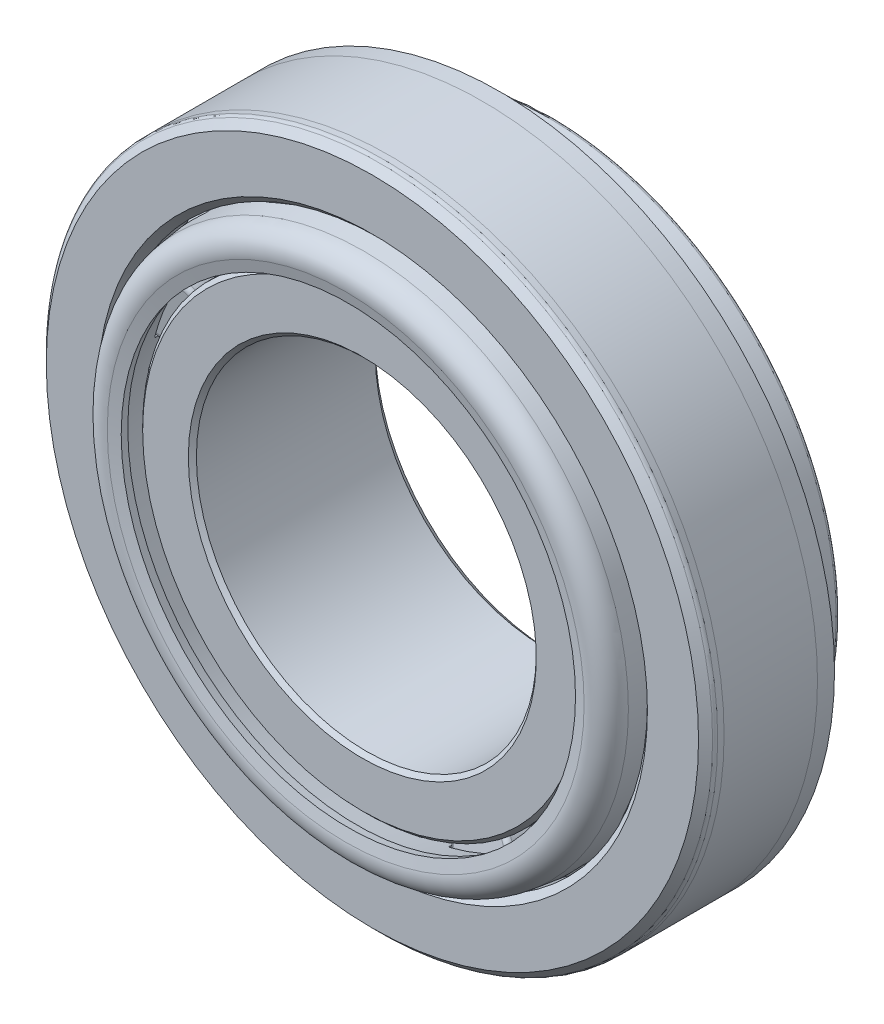
from build123d import *
from OCP.BRepFilletAPI import BRepFilletAPI_MakeChamfer

# Parameters (mm, degrees)
SKETCH8_R                 = 1.3275
CUT_EXTRUDE1_DEPTH        = 0.635
FILLET7_R                 = 0.9525
CHAMFER4_SIZE             = 0.331875
CHAMFER4_SIZE2            = 0.322096273
FILLET8_R                 = 0.3585
CIRPATTERN1_COUNT         = 16
FILLET9_R                 = 1.6
FILLET10_R                = 0.2145
FILLET11_R                = 0.239
CIRPATTERN2_COUNT         = 16
FILLET11_OF_CIRPATTERN2_R = 0.239
CHAMFER1_SIZE             = 0.6364125
CHAMFER1_SIZE2            = 0.519546857
FILLET6_R                 = 0.3818475
CHAMFER2_SIZE             = 0.301125
CHAMFER3_SIZE             = 0.5825


with BuildPart() as part:
    # Sketch2 → Revolve1 (revolve)
    with BuildSketch(Plane(origin=(0, 0, 0), x_dir=(0, 0, -1), z_dir=(1, 0, 0)), mode=Mode.PRIVATE) as revolve1_sk:
        Polygon((-4.7625, 25.0063), (-4.7625, 19.915), (4.7625, 22.47), (4.7625, 25.0063), align=None)
    revolve(revolve1_sk.sketch.rotate(Axis((0, 0, 0), (0, 0, -1)), 90), axis=Axis((0, 0, 0), (0, 0, -1)))

    # Chamfer1: one chamfer whose edges measure the first distance from different faces: ONE call of the kernel's chamfer builder (chamfer() names one face for all edges)
    chamfer1_edges_1 = [part.edges().sort_by_distance(p)[0] for p in [
        (-19.915, 0, 4.7625),
    ]]
    chamfer1_side_1 = [part.faces().sort_by_distance(p)[0] for p in [
        (-24.299015028, 0, 4.7625),
    ]]
    chamfer1_edges_2 = [part.edges().sort_by_distance(p)[0] for p in [
        (-25.0063, 0, 4.7625),
    ]]
    chamfer1 = BRepFilletAPI_MakeChamfer(part.part.solid().wrapped)
    for e in chamfer1_edges_1:
        chamfer1.Add(CHAMFER1_SIZE, CHAMFER1_SIZE2, e.wrapped, chamfer1_side_1[0].wrapped)  # the first distance lies on this face
    for e in chamfer1_edges_2:
        chamfer1.Add(CHAMFER1_SIZE, e.wrapped)
    add(Compound.cast(chamfer1.Shape()), mode=Mode.REPLACE)

    # Fillet6
    fillet6_edges = [part.edges().sort_by_distance(p)[0] for p in [
        (-25.0063, 0, 4.1260875),
    ]]
    fillet(fillet6_edges, radius=FILLET6_R)


with BuildPart() as body_2:
    # Sketch3 → Revolve2 (revolve)
    with BuildSketch(Plane(origin=(0, 0, 0), x_dir=(0, 0, -1), z_dir=(1, 0, 0)), mode=Mode.PRIVATE) as revolve2_sk:
        Polygon((-5.51688, 16.715), (-5.51688, 12.7), (8.73252, 12.7), (8.73252, 18.525), (5.040483008, 18.525), (5.367251191, 17.137115196), (-3.054855979, 15.426432346), (-3.358240605, 16.715), align=None)
    revolve(revolve2_sk.sketch.rotate(Axis((0, 0, 0), (0, 0, -1)), 90), axis=Axis((0, 0, 0), (0, 0, -1)))

    # Chamfer2
    chamfer2_edges = [body_2.edges().sort_by_distance(p)[0] for p in [
        (-12.7, 0, 5.51688),
        (-16.715, 0, 5.51688),
    ]]
    chamfer(chamfer2_edges, length=CHAMFER2_SIZE)

    # Chamfer3
    chamfer3_edges = [body_2.edges().sort_by_distance(p)[0] for p in [
        (-18.525, 0, -8.73252),
        (-12.7, 0, -8.73252),
    ]]
    chamfer(chamfer3_edges, length=CHAMFER3_SIZE)


with BuildPart() as body_3:
    # Sketch4 → Revolve3 (revolve)
    with BuildSketch(Plane(origin=(0, 0, 0), x_dir=(0, 0, -1), z_dir=(1, 0, 0)), mode=Mode.PRIVATE) as revolve3_sk:
        Polygon((8.70712, 20.907896237), (8.555863227, 21.550330194), (-7.164983268, 19.543904717), (-6.559994841, 16.97433311), (-5.917560884, 17.125589883), (-5.99318927, 17.446806861), align=None)
    revolve(revolve3_sk.sketch.rotate(Axis((0, 0, 0), (0, 0, -1)), 90), axis=Axis((0, 0, 0), (0, 0, -1)))

    # Fillet9
    fillet9_edges = [body_3.edges().sort_by_distance(p)[0] for p in [
        (-19.543904717, 0, 7.164983268),
    ]]
    fillet(fillet9_edges, radius=FILLET9_R)

    # Fillet10
    fillet10_edges = [body_3.edges().sort_by_distance(p)[0] for p in [
        (-21.550330194, 0, -8.555863227),
        (-20.907896237, 0, -8.70712),
    ]]
    fillet(fillet10_edges, radius=FILLET10_R)

    # Sketch9 → Cut-Revolve2 (revolve, cut)
    with BuildSketch(Plane(origin=(0, 0, 0), x_dir=(0, 0, -1), z_dir=(1, 0, 0)), mode=Mode.PRIVATE) as cut_revolve2_sk:
        Polygon((-3.602588839, 17.752821976), (4.758786445, 19.721451794), (5.408350699, 16.962552967), (-3.013756471, 15.251870116), align=None)
    cut_revolve2 = revolve(cut_revolve2_sk.sketch.rotate(Axis((0, 17.752821976, 3.602588839), (0, 0.2291769287577538, -0.9733847827684402)), 180), axis=Axis((0, 17.752821976, 3.602588839), (0, 0.2291769287577538, -0.9733847827684402)), mode=Mode.SUBTRACT)

    # Fillet11
    fillet11_edges = [body_3.edges().sort_by_distance(p)[0] for p in [
        (-2.222070994, 19.008406949, 3.898207913),
        (2.222070994, 19.008406949, 3.898207913),
        (2.763109607, 20.336059128, -4.614081264),
        (-2.763109607, 20.336059128, -4.614081264),
    ]]
    fillet(fillet11_edges, radius=FILLET11_R)

    # CirPattern2: Cut-Revolve2 ×16 about axis
    cirpattern2_axis = Axis((0, 0, 0), (0, 0, 1))
    for i in range(1, CIRPATTERN2_COUNT):
        add(cut_revolve2.rotate(cirpattern2_axis, i * 360 / CIRPATTERN2_COUNT), mode=Mode.SUBTRACT)

    # Fillet11 of CirPattern2
    fillet11_of_cirpattern2_edges = [body_3.edges().sort_by_distance(p)[0] for p in [
        (-9.327128327, 16.711128371, 3.898207913),
        (-5.221276504, 18.411827881, 3.898207913),
        (-5.229492496, 19.845465069, -4.614081264),
        (-10.33505332, 17.730672532, -4.614081264),
        (-15.012214922, 11.869731985, 3.898207913),
        (-11.869731985, 15.012214922, 3.898207913),
        (-12.425951772, 16.333578852, -4.614081264),
        (-16.333578852, 12.425951772, -4.614081264),
        (-18.411827881, 5.221276504, 3.898207913),
        (-16.711128371, 9.327128327, 3.898207913),
        (-17.730672532, 10.33505332, -4.614081264),
        (-19.845465069, 5.229492496, -4.614081264),
        (-19.008406949, -2.222070994, 3.898207913),
        (-19.008406949, 2.222070994, 3.898207913),
        (-20.336059128, 2.763109607, -4.614081264),
        (-20.336059128, -2.763109607, -4.614081264),
        (-16.711128371, -9.327128327, 3.898207913),
        (-18.411827881, -5.221276504, 3.898207913),
        (-19.845465069, -5.229492496, -4.614081264),
        (-17.730672532, -10.33505332, -4.614081264),
        (-11.869731985, -15.012214922, 3.898207913),
        (-15.012214922, -11.869731985, 3.898207913),
        (-16.333578852, -12.425951772, -4.614081264),
        (-12.425951772, -16.333578852, -4.614081264),
        (-5.221276504, -18.411827881, 3.898207913),
        (-9.327128327, -16.711128371, 3.898207913),
        (-10.33505332, -17.730672532, -4.614081264),
        (-5.229492496, -19.845465069, -4.614081264),
        (2.222070994, -19.008406949, 3.898207913),
        (-2.222070994, -19.008406949, 3.898207913),
        (-2.763109607, -20.336059128, -4.614081264),
        (2.763109607, -20.336059128, -4.614081264),
        (9.327128327, -16.711128371, 3.898207913),
        (5.221276504, -18.411827881, 3.898207913),
        (5.229492496, -19.845465069, -4.614081264),
        (10.33505332, -17.730672532, -4.614081264),
        (15.012214922, -11.869731985, 3.898207913),
        (11.869731985, -15.012214922, 3.898207913),
        (12.425951772, -16.333578852, -4.614081264),
        (16.333578852, -12.425951772, -4.614081264),
        (18.411827881, -5.221276504, 3.898207913),
        (16.711128371, -9.327128327, 3.898207913),
        (17.730672532, -10.33505332, -4.614081264),
        (19.845465069, -5.229492496, -4.614081264),
        (19.008406949, 2.222070994, 3.898207913),
        (19.008406949, -2.222070994, 3.898207913),
        (20.336059128, -2.763109607, -4.614081264),
        (20.336059128, 2.763109607, -4.614081264),
        (16.711128371, 9.327128327, 3.898207913),
        (18.411827881, 5.221276504, 3.898207913),
        (19.845465069, 5.229492496, -4.614081264),
        (17.730672532, 10.33505332, -4.614081264),
        (11.869731985, 15.012214922, 3.898207913),
        (15.012214922, 11.869731985, 3.898207913),
        (16.333578852, 12.425951772, -4.614081264),
        (12.425951772, 16.333578852, -4.614081264),
        (5.221276504, 18.411827881, 3.898207913),
        (9.327128327, 16.711128371, 3.898207913),
        (10.33505332, 17.730672532, -4.614081264),
        (5.229492496, 19.845465069, -4.614081264),
    ]]
    fillet(fillet11_of_cirpattern2_edges, radius=FILLET11_OF_CIRPATTERN2_R)


with BuildPart() as body_4:
    # Sketch6 → Revolve4 (revolve)
    with BuildSketch(Plane(origin=(0, 0, 0), x_dir=(0, 0, -1), z_dir=(1, 0, 0))):
        Polygon((5.367251191, 17.137115196), (4.758786445, 19.721451794), (-3.602588839, 17.752821976), (-3.054855979, 15.426432346), align=None)
    revolve(axis=Axis((0, 17.752821976, 3.602588839), (0, 0.22917692875775356, -0.9733847827684402)))

    # Sketch8 → Cut-Extrude1 (cut)
    with BuildSketch(Plane(origin=(0, 2.097388765, -8.908254064), x_dir=(-1, 0, 0), z_dir=(0, 0.22917692875775356, -0.9733847827684402))):
        with Locations(Location((0, 18.105957009, 0), (0, 0, 90))):
            Circle(SKETCH8_R)
    extrude(amount=-CUT_EXTRUDE1_DEPTH, mode=Mode.SUBTRACT)

    # Fillet7
    # the kernel refuses this fillet: 0.9525 mm, written as the material it adds along each edge
    with BuildSketch(Plane(origin=(0, 19.575924445, -4.140687108), x_dir=(0, 0.9733847827684403, 0.22917692875775314), z_dir=(-1, 0, 0))) as fillet7_piece_1:
        with BuildLine():
            CenterArc((0.429474388, 0.9525), FILLET7_R, 270, 70.528779366)
            Line((0.429474388, 0), (0.429474388, -0.01905))
            Line((0.429474388, -0.01905), (1.3275, -0.01905))
            Line((1.3275, -0.01905), (1.34655, 0))
            ThreePointArc((1.34655, 0), (1.34655, 0.3175), (1.345460512, 0.62865))
            Line((1.345460512, 0.62865), (1.3275, 0.635))
        make_face()
    revolve(axis=Axis((0, 19.575924445, -4.140687108), (0, 0.22917692875775356, -0.9733847827684402)))

    # Chamfer4
    chamfer4_edges = [body_4.edges().sort_by_distance(p)[0] for p in [
        (0, 22.305788393, -4.150321699),
    ]]
    chamfer4_side = [body_4.faces().sort_by_distance(p)[0] for p in [
        (0, 22.232692315, -4.167531681),
    ]]
    chamfer(chamfer4_edges, length=CHAMFER4_SIZE, length2=CHAMFER4_SIZE2, reference=chamfer4_side[0])

    # Fillet8
    fillet8_edges = [body_4.edges().sort_by_distance(p)[0] for p in [
        (0, 20.079211607, 4.150321699),
    ]]
    fillet(fillet8_edges, radius=FILLET8_R)


with BuildPart() as cirpattern1_1:
    # CirPattern1: pattern copy
    add(body_4.part.rotate(Axis((0, 0, 0), (0, 0, 1)), 1 * 360 / CIRPATTERN1_COUNT))


with BuildPart() as cirpattern1_2:
    # CirPattern1: pattern copy
    add(body_4.part.rotate(Axis((0, 0, 0), (0, 0, 1)), 2 * 360 / CIRPATTERN1_COUNT))


with BuildPart() as cirpattern1_3:
    # CirPattern1: pattern copy
    add(body_4.part.rotate(Axis((0, 0, 0), (0, 0, 1)), 3 * 360 / CIRPATTERN1_COUNT))


with BuildPart() as cirpattern1_4:
    # CirPattern1: pattern copy
    add(body_4.part.rotate(Axis((0, 0, 0), (0, 0, 1)), 4 * 360 / CIRPATTERN1_COUNT))


with BuildPart() as cirpattern1_5:
    # CirPattern1: pattern copy
    add(body_4.part.rotate(Axis((0, 0, 0), (0, 0, 1)), 5 * 360 / CIRPATTERN1_COUNT))


with BuildPart() as cirpattern1_6:
    # CirPattern1: pattern copy
    add(body_4.part.rotate(Axis((0, 0, 0), (0, 0, 1)), 6 * 360 / CIRPATTERN1_COUNT))


with BuildPart() as cirpattern1_7:
    # CirPattern1: pattern copy
    add(body_4.part.rotate(Axis((0, 0, 0), (0, 0, 1)), 7 * 360 / CIRPATTERN1_COUNT))


with BuildPart() as cirpattern1_8:
    # CirPattern1: pattern copy
    add(body_4.part.rotate(Axis((0, 0, 0), (0, 0, 1)), 8 * 360 / CIRPATTERN1_COUNT))


with BuildPart() as cirpattern1_9:
    # CirPattern1: pattern copy
    add(body_4.part.rotate(Axis((0, 0, 0), (0, 0, 1)), 9 * 360 / CIRPATTERN1_COUNT))


with BuildPart() as cirpattern1_10:
    # CirPattern1: pattern copy
    add(body_4.part.rotate(Axis((0, 0, 0), (0, 0, 1)), 10 * 360 / CIRPATTERN1_COUNT))


with BuildPart() as cirpattern1_11:
    # CirPattern1: pattern copy
    add(body_4.part.rotate(Axis((0, 0, 0), (0, 0, 1)), 11 * 360 / CIRPATTERN1_COUNT))


with BuildPart() as cirpattern1_12:
    # CirPattern1: pattern copy
    add(body_4.part.rotate(Axis((0, 0, 0), (0, 0, 1)), 12 * 360 / CIRPATTERN1_COUNT))


with BuildPart() as cirpattern1_13:
    # CirPattern1: pattern copy
    add(body_4.part.rotate(Axis((0, 0, 0), (0, 0, 1)), 13 * 360 / CIRPATTERN1_COUNT))


with BuildPart() as cirpattern1_14:
    # CirPattern1: pattern copy
    add(body_4.part.rotate(Axis((0, 0, 0), (0, 0, 1)), 14 * 360 / CIRPATTERN1_COUNT))


with BuildPart() as cirpattern1_15:
    # CirPattern1: pattern copy
    add(body_4.part.rotate(Axis((0, 0, 0), (0, 0, 1)), 15 * 360 / CIRPATTERN1_COUNT))


solid = Compound([part.part, body_2.part, body_3.part, body_4.part, cirpattern1_1.part, cirpattern1_2.part, cirpattern1_3.part, cirpattern1_4.part, cirpattern1_5.part, cirpattern1_6.part, cirpattern1_7.part, cirpattern1_8.part, cirpattern1_9.part, cirpattern1_10.part, cirpattern1_11.part, cirpattern1_12.part, cirpattern1_13.part, cirpattern1_14.part, cirpattern1_15.part])
